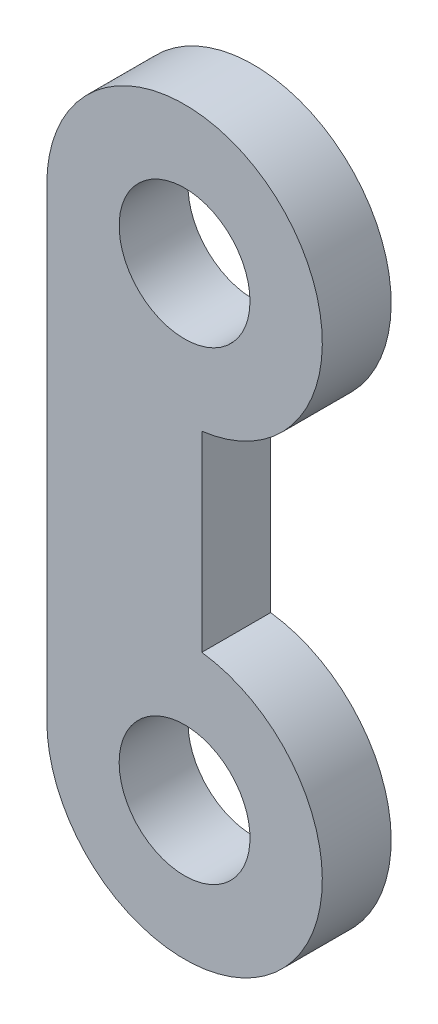
from build123d import *

# Parameters (mm, degrees)
SKETCH1_R           = 1.9
BOSS_EXTRUDE1_DEPTH = 2


with BuildPart() as part:
    # Sketch1 → Boss-Extrude1 (new body)
    with BuildSketch(Plane.XY):
        with BuildLine():
            Line((-0.126223669, 2.781373033), (-0.126223669, -2.781373033))
            ThreePointArc((-0.126223669, -2.781373033), (2.019527642, -9.75), (-4.626223669, -6.75))
            Line((-4.626223669, -6.75), (-4.626223669, 6.75))
            ThreePointArc((-4.626223669, 6.75), (2.019527642, 9.75), (-0.126223669, 2.781373033))
        make_face()
        with Locations((-0.626223669, 6.75)):
            Circle(SKETCH1_R, mode=Mode.SUBTRACT)
        with Locations((-0.626223669, -6.75)):
            Circle(SKETCH1_R, mode=Mode.SUBTRACT)
    extrude(amount=BOSS_EXTRUDE1_DEPTH)


solid = part.part
